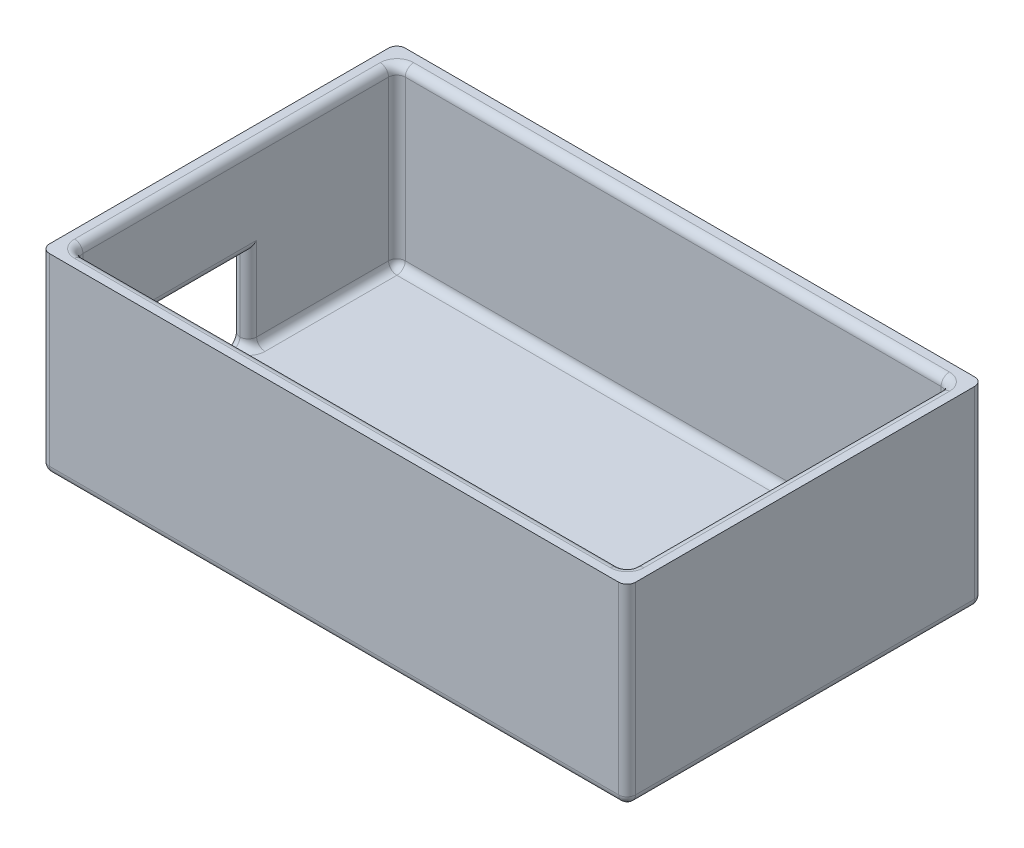
from build123d import *

# Parameters (mm, degrees)
SKETCH1_W           = 70
SKETCH1_H           = 42.5
BOSS_EXTRUDE1_DEPTH = 2
BOSS_EXTRUDE2_DEPTH = 21
SKETCH3_W           = 2
SKETCH3_H           = 12.5
BOSS_EXTRUDE3_DEPTH = 11
FILLET2_R           = 1


with BuildPart() as part:
    # Sketch1 → Boss-Extrude1 (new body)
    with BuildSketch(Plane(origin=(0, 0, 0), x_dir=(1, 0, 0), z_dir=(0, 1, 0))):
        Rectangle(SKETCH1_W, SKETCH1_H)
    extrude(amount=-BOSS_EXTRUDE1_DEPTH)

    # Sketch2 → Boss-Extrude2 (add)
    with BuildSketch(Plane(origin=(0, 0, 0), x_dir=(-1, 0, 0), z_dir=(0, 1, 0))):
        Polygon((-33, 19.25), (33, 19.25), (33, 11), (35, 11), (35, 21.25), (-35, 21.25), (-35, -21.25), (35, -21.25), (35, -1.5), (33, -1.5), (33, -19.25), (-33, -19.25), align=None)
    extrude(amount=BOSS_EXTRUDE2_DEPTH)

    # Sketch3 → Boss-Extrude3 (add)
    with BuildSketch(Plane(origin=(0, 21, 0), x_dir=(1, 0, 0), z_dir=(0, 1, 0))):
        with Locations((-34, -4.75)):
            Rectangle(SKETCH3_W, SKETCH3_H)
    extrude(amount=-BOSS_EXTRUDE3_DEPTH)

    # Fillet2
    fillet2_edges = [part.edges().sort_by_distance(p)[0] for p in [
        (35, -2, 0),
        (-35, 0, 4.75),
        (0, -2, -21.25),
        (-33, 0, -10.375),
        (0, 0, -19.25),
        (-33, 10.5, -19.25),
        (33, 21, 0),
        (33, 10.5, -19.25),
        (0, 21, 19.25),
        (33, 10.5, 19.25),
        (-33, 0, 15.125),
        (-33, 10.5, 19.25),
        (-34, 0, 11),
        (-33, 21, 0),
        (0, 21, -19.25),
        (-34, 0, -1.5),
        (0, 0, 19.25),
        (33, 0, 0),
        (-35, 5, 11),
        (-33, 5, 11),
        (-33, 5, -1.5),
        (-35, 5, -1.5),
        (-35, -2, 0),
        (-33, 10, 4.75),
        (-35, 10, 4.75),
        (-35, 9.5, -21.25),
        (35, 9.5, -21.25),
        (35, 9.5, 21.25),
        (-35, 9.5, 21.25),
        (0, -2, 21.25),
    ]]
    fillet(fillet2_edges, radius=FILLET2_R - 0.0001)  # a hair under: the kernel refuses the full size


solid = part.part
